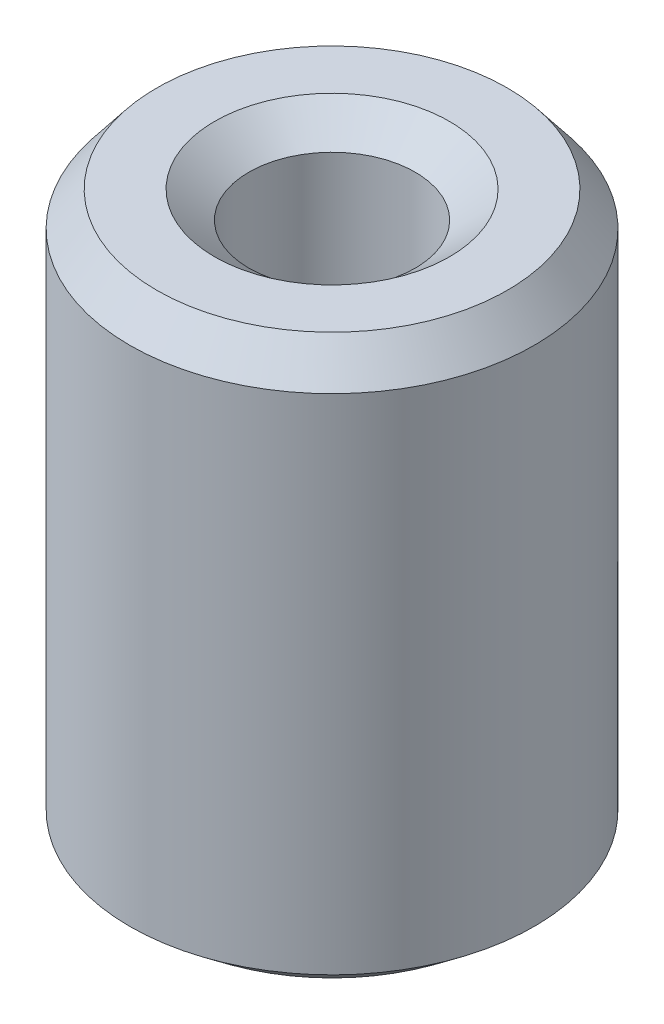
from build123d import *
from OCP.BRepFilletAPI import BRepFilletAPI_MakeChamfer

# Parameters (mm, degrees)
SKETCH1_R           = 7.5
BOSS_EXTRUDE1_DEPTH = 20.935869464
SKETCH2_R           = 3.086213291
CUT_EXTRUDE1_DEPTH  = 24.46935513
CHAMFER1_SIZE       = 1.269010485
CHAMFER1_SIZE2      = 0.997489416


with BuildPart() as part:
    # Sketch1 → Boss-Extrude1 (new body)
    with BuildSketch(Plane(origin=(0, 0, 0), x_dir=(1, 0, 0), z_dir=(0, 1, 0))):
        Circle(SKETCH1_R)
    extrude(amount=BOSS_EXTRUDE1_DEPTH)

    # Sketch2 → Cut-Extrude1 (cut, through all)
    with BuildSketch(Plane(origin=(0, 0, 0), x_dir=(1, 0, 0), z_dir=(0, 1, 0))):
        Circle(SKETCH2_R)
    extrude(amount=CUT_EXTRUDE1_DEPTH, mode=Mode.SUBTRACT)

    # Chamfer1: one chamfer whose edges measure the first distance from different faces: ONE call of the kernel's chamfer builder (chamfer() names one face for all edges)
    chamfer1_edges_1 = [part.edges().sort_by_distance(p)[0] for p in [
        (-3.086213291, 20.935869464, 0),
    ]]
    chamfer1_side_1 = [part.faces().sort_by_distance(p)[0] for p in [
        (-7.287867966, 20.935869464, 0),
    ]]
    chamfer1_edges_2 = [part.edges().sort_by_distance(p)[0] for p in [
        (-3.086213291, 0, 0),
    ]]
    chamfer1_side_2 = [part.faces().sort_by_distance(p)[0] for p in [
        (-3.086213291, 10.467934732, 0),
    ]]
    chamfer1_edges_3 = [part.edges().sort_by_distance(p)[0] for p in [
        (-7.5, 0, 0),
    ]]
    chamfer1_side_3 = [part.faces().sort_by_distance(p)[0] for p in [
        (-7.287867966, 0, 0),
    ]]
    chamfer1_edges_4 = [part.edges().sort_by_distance(p)[0] for p in [
        (-7.5, 20.935869464, 0),
    ]]
    chamfer1_side_4 = [part.faces().sort_by_distance(p)[0] for p in [
        (-7.5, 10.467934732, 0),
    ]]
    chamfer1 = BRepFilletAPI_MakeChamfer(part.part.solid().wrapped)
    for e in chamfer1_edges_1:
        chamfer1.Add(CHAMFER1_SIZE, CHAMFER1_SIZE2, e.wrapped, chamfer1_side_1[0].wrapped)  # the first distance lies on this face
    for e in chamfer1_edges_2:
        chamfer1.Add(CHAMFER1_SIZE, CHAMFER1_SIZE2, e.wrapped, chamfer1_side_2[0].wrapped)  # the first distance lies on this face
    for e in chamfer1_edges_3:
        chamfer1.Add(CHAMFER1_SIZE, CHAMFER1_SIZE2, e.wrapped, chamfer1_side_3[0].wrapped)  # the first distance lies on this face
    for e in chamfer1_edges_4:
        chamfer1.Add(CHAMFER1_SIZE, CHAMFER1_SIZE2, e.wrapped, chamfer1_side_4[0].wrapped)  # the first distance lies on this face
    add(Compound.cast(chamfer1.Shape()), mode=Mode.REPLACE)


solid = part.part
